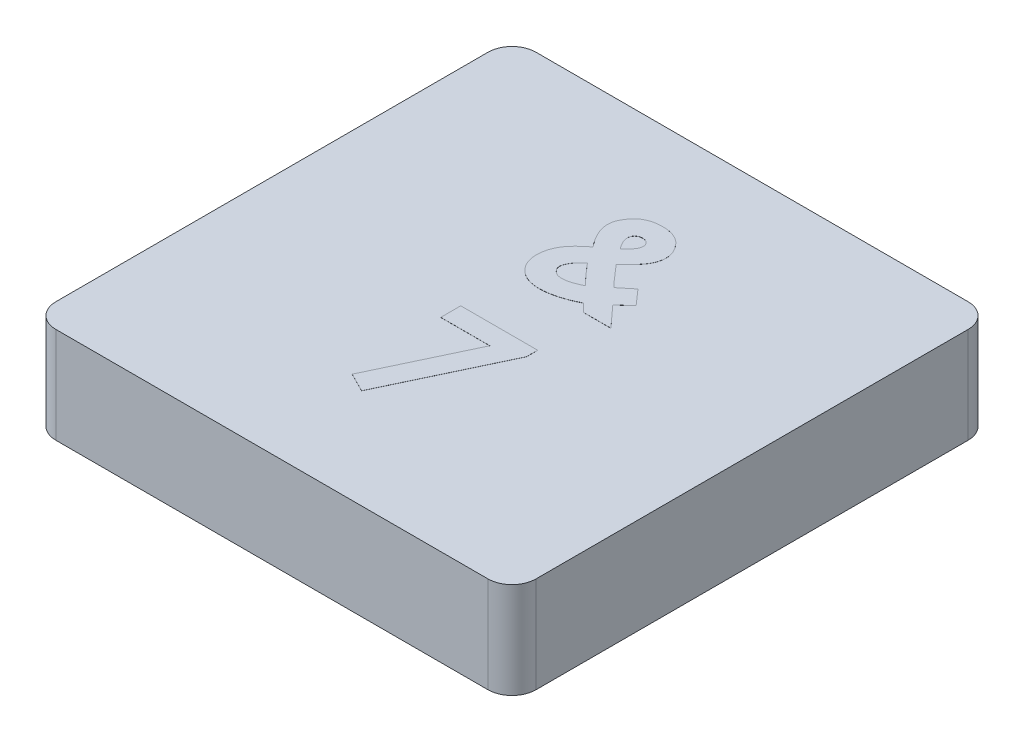
from build123d import *

# Parameters (mm, degrees)
SKETCH1_W           = 12.7
SKETCH1_H           = 12.7
BOSS_EXTRUDE1_DEPTH = 2.54
FILLET1_R           = 0.635
SHELL1_START        = 0.635
SHELL1_OUTLINE_W    = 1.905
SHELL1_OUTLINE_H    = 11.43
SHELL1_DEPTH        = 11.43
SKETCH2_R           = 2.54
BOSS_EXTRUDE2_DEPTH = 1.905
BOSS_EXTRUDE4_DEPTH = 0.00254


# Read off the part's stored shape, not the designer's step: Shell1
with BuildPart() as part:
    # Sketch1 → Boss-Extrude1 (new body)
    with BuildSketch(Plane(origin=(0, 0, 0), x_dir=(1, 0, 0), z_dir=(0, 1, 0))):
        with Locations((6.35, 6.35)):
            Rectangle(SKETCH1_W, SKETCH1_H)
    extrude(amount=BOSS_EXTRUDE1_DEPTH)

    # Fillet1
    fillet1_edges = [part.edges().sort_by_distance(p)[0] for p in [
        (0, 1.27, -12.7),
        (12.7, 1.27, -12.7),
        (12.7, 1.27, 0),
        (0, 1.27, 0),
    ]]
    fillet(fillet1_edges, radius=FILLET1_R)

    # Shell1 outline → Shell1 (cut)
    with BuildSketch(Plane.YZ.offset(SHELL1_START)):
        with Locations((0.9525, -6.35)):
            Rectangle(SHELL1_OUTLINE_W, SHELL1_OUTLINE_H)
    extrude(amount=SHELL1_DEPTH, mode=Mode.SUBTRACT)

    # Sketch2 → Boss-Extrude2 (add)
    with BuildSketch(Plane(origin=(0, 1.905, 0), x_dir=(-1, 0, 0), z_dir=(0, -1, 0))):
        with Locations(Location((-6.35, 6.35, 0), (0, 0, 270))):
            Circle(SKETCH2_R)
    extrude(amount=BOSS_EXTRUDE2_DEPTH)

    # Sketch4 → Boss-Extrude4 (add)
    # profile 1 of 2: a face of its own
    with BuildSketch(Plane(origin=(0, 2.54, 0), x_dir=(1, 0, 0), z_dir=(0, 1, 0))):
        Polygon((5.451230769, 5.8928), (7.486487179, 5.8928), (7.486487179, 5.597051803), (6.085976362, 2.636389744), (5.580978365, 2.890796795), (6.751250801, 5.363633333), (5.451230769, 5.363633333), align=None)
    # profile 2 of 2: a face of its own
    with BuildSketch(Plane(origin=(0, 2.54, 0), x_dir=(1, 0, 0), z_dir=(0, 1, 0))):
        with BuildLine():
            Line((7.409096554, 8.622770833), (7.766538462, 8.216991587))
            Line((7.766538462, 8.216991587), (7.603081931, 8.069435497))
            Line((7.603081931, 8.069435497), (7.441533454, 7.924423478))
            Line((7.441533454, 7.924423478), (7.949711538, 7.366))
            Line((7.949711538, 7.366), (7.222743389, 7.366))
            Line((7.222743389, 7.366), (7.015401643, 7.580973958))
            add(Edge.make_bspline(
                [(7.015401643, 7.580973958), (6.97444801, 7.560673161), (6.894181, 7.520884644), (6.773253322, 7.468717966), (6.654685877, 7.424432773), (6.538018022, 7.388798773), (6.423564891, 7.360717899), (6.311277459, 7.340102208), (6.201167743, 7.327468775), (6.128400542, 7.326012527), (6.092540064, 7.325294872)],
                knots=[0, 0, 0, 0, 1.134891057, 2.224328022, 3.268734328, 4.276239557, 5.251753187, 6.19349853, 7.109736169, 8, 8, 8, 8], degree=3))
            add(Edge.make_bspline(
                [(6.092540064, 7.325294872), (6.063034429, 7.325796424), (6.005322209, 7.326777447), (5.921188748, 7.337631506), (5.840996101, 7.353018844), (5.765418119, 7.376002636), (5.693887229, 7.405330125), (5.627212867, 7.442085237), (5.563639801, 7.483658229), (5.506101146, 7.532882757), (5.454020224, 7.586857726), (5.408064059, 7.644561561), (5.369257191, 7.706362361), (5.338512477, 7.772171642), (5.312977544, 7.841118603), (5.296538962, 7.914080952), (5.284832221, 7.990403359), (5.283968057, 8.04267472), (5.283525641, 8.069435497)],
                knots=[0, 0, 0, 0, 1.146320485, 2.242171696, 3.292771085, 4.317415236, 5.307674559, 6.292327784, 7.272937241, 8.255380553, 9.228759612, 10.185102518, 11.118113404, 12.058159412, 13.004506672, 13.970038596, 14.960743665, 16, 16, 16, 16], degree=3))
            add(Edge.make_bspline(
                [(5.283525641, 8.069435497), (5.285136738, 8.110051238), (5.288345469, 8.1909433), (5.313640854, 8.310302809), (5.353809539, 8.426236269), (5.400952856, 8.519265038), (5.446819309, 8.59254431), (5.488720732, 8.647552338), (5.535160587, 8.703790883), (5.587347614, 8.760305349), (5.645545647, 8.817160167), (5.709882384, 8.873904262), (5.77900736, 8.932164365), (5.828205116, 8.96940926), (5.853397436, 8.98848097)],
                knots=[0, 0, 0, 0, 1.298446345, 2.586041726, 3.88590443, 5.214452458, 5.912551437, 6.649127465, 7.424614693, 8.245404032, 9.108723099, 10.02626188, 10.989322942, 12, 12, 12, 12], degree=3))
            add(Edge.make_bspline(
                [(5.853397436, 8.98848097), (5.827559755, 9.021257842), (5.777543868, 9.084706429), (5.711505763, 9.181511898), (5.655141147, 9.275021591), (5.608821582, 9.36561685), (5.572908738, 9.453473314), (5.547117983, 9.53858128), (5.530925354, 9.620914059), (5.528793375, 9.675100959), (5.52775641, 9.701456731)],
                knots=[0, 0, 0, 0, 1.254783331, 2.428975762, 3.521264868, 4.536304978, 5.485798762, 6.371253184, 7.2077997, 8, 8, 8, 8], degree=3))
            add(Edge.make_bspline(
                [(5.52775641, 9.701456731), (5.528380522, 9.720574249), (5.52963638, 9.759043148), (5.539526331, 9.816440273), (5.555794207, 9.873650013), (5.577737669, 9.930734936), (5.607306284, 9.987010631), (5.64120406, 10.043977629), (5.683245259, 10.099801566), (5.73026093, 10.155323483), (5.782631122, 10.208133579), (5.842073232, 10.253340749), (5.90566613, 10.292692093), (5.975384272, 10.323685635), (6.049609796, 10.348752242), (6.129486339, 10.365421702), (6.21411159, 10.376845296), (6.272492276, 10.377727271), (6.302425881, 10.378179487)],
                knots=[0, 0, 0, 0, 0.804005245, 1.617845782, 2.442417892, 3.303751945, 4.185353306, 5.113895693, 6.089730109, 7.121057753, 8.174368357, 9.210928466, 10.255745102, 11.313577991, 12.413626417, 13.545577246, 14.741540635, 16, 16, 16, 16], degree=3))
            add(Edge.make_bspline(
                [(6.302425881, 10.378179487), (6.332569573, 10.377722536), (6.39136896, 10.376831189), (6.476650223, 10.365468143), (6.556816829, 10.348636143), (6.631527852, 10.324533868), (6.700880775, 10.293161466), (6.764602292, 10.254855776), (6.823488659, 10.210021647), (6.875164543, 10.157828093), (6.921772987, 10.103243061), (6.961995209, 10.047470902), (6.996705175, 9.991938863), (7.025405352, 9.936359946), (7.047480339, 9.880322284), (7.062578015, 9.823963437), (7.072683503, 9.767539145), (7.073933625, 9.729694947), (7.074551282, 9.710996995)],
                knots=[0, 0, 0, 0, 1.276734626, 2.490445286, 3.63953842, 4.744903521, 5.810549869, 6.858432609, 7.890047049, 8.938430496, 9.964709099, 10.929889513, 11.849973453, 12.738086576, 13.577403443, 14.397009003, 15.207998884, 16, 16, 16, 16], degree=3))
            add(Edge.make_bspline(
                [(7.074551282, 9.710996995), (7.073477523, 9.681652887), (7.07134243, 9.623304189), (7.053209703, 9.536924488), (7.024449419, 9.452542626), (6.990618023, 9.383157447), (6.955339528, 9.326322118), (6.921196083, 9.27845718), (6.879896691, 9.225755696), (6.830529284, 9.168763191), (6.774558566, 9.106216415), (6.710774983, 9.038936218), (6.639742376, 8.966412127), (6.588968556, 8.917335112), (6.562557091, 8.89180629)],
                knots=[0, 0, 0, 0, 1.060977453, 2.109679181, 3.179605993, 4.281004361, 4.894184227, 5.598751118, 6.407550161, 7.316246525, 8.32673215, 9.444732117, 10.670803848, 12, 12, 12, 12], degree=3))
            add(Edge.make_bspline(
                [(6.562557091, 8.89180629), (6.593271294, 8.856166083), (6.651652628, 8.788421434), (6.73506492, 8.69246567), (6.809433761, 8.606610115), (6.876491377, 8.532369572), (6.933052055, 8.466733094), (6.983103843, 8.413663099), (7.023637363, 8.370251662), (7.048022863, 8.34501693), (7.058650841, 8.33401883)],
                knots=[0, 0, 0, 0, 1.512435367, 2.874826234, 4.08718363, 5.163660462, 6.090727043, 6.871951442, 7.508360509, 8, 8, 8, 8], degree=3))
            add(Edge.make_bspline(
                [(7.058650841, 8.33401883), (7.065417498, 8.339341484), (7.081216274, 8.351768806), (7.108880844, 8.372508864), (7.142506332, 8.400242817), (7.182820765, 8.433739543), (7.23008464, 8.472510346), (7.28372058, 8.517247148), (7.343948587, 8.568147254), (7.386610982, 8.603917714), (7.409096554, 8.622770833)],
                knots=[0, 0, 0, 0, 0.454985294, 1.062298784, 1.826991184, 2.758032328, 3.832541496, 5.05766532, 6.449217892, 8, 8, 8, 8], degree=3))
        make_face()
        with BuildLine():
            add(Edge.make_bspline(
                [(6.256632612, 9.310305889), (6.276099643, 9.326643614), (6.3134892, 9.358022836), (6.364210213, 9.406054817), (6.407572479, 9.452686593), (6.44240454, 9.498116851), (6.469920541, 9.542127789), (6.489901968, 9.584432629), (6.50226988, 9.625930388), (6.503893913, 9.653257267), (6.504679487, 9.666475761)],
                knots=[0, 0, 0, 0, 1.365060885, 2.621818505, 3.750342301, 4.782258275, 5.692552235, 6.533361441, 7.290560982, 8, 8, 8, 8], degree=3))
            add(Edge.make_bspline(
                [(6.504679487, 9.666475761), (6.504271465, 9.67951412), (6.503486032, 9.704612637), (6.491637727, 9.73989146), (6.474580642, 9.772079792), (6.449300477, 9.79898587), (6.419253722, 9.821875675), (6.383705957, 9.837510165), (6.343884895, 9.847485525), (6.315848087, 9.848487618), (6.301153846, 9.849012821)],
                knots=[0, 0, 0, 0, 1.014099219, 1.952115937, 2.87909245, 3.840951669, 4.811901314, 5.812921866, 6.853740603, 8, 8, 8, 8], degree=3))
            add(Edge.make_bspline(
                [(6.301153846, 9.849012821), (6.287542113, 9.848167376), (6.260781107, 9.846505211), (6.221787318, 9.836691055), (6.187107944, 9.817268809), (6.155981618, 9.792706314), (6.130326793, 9.763353415), (6.110957761, 9.730741837), (6.099973772, 9.695148684), (6.098413392, 9.670573715), (6.097628205, 9.658207532)],
                knots=[0, 0, 0, 0, 1.057365327, 2.078806644, 3.087050319, 4.117196135, 5.143130812, 6.093917617, 7.040854779, 8, 8, 8, 8], degree=3))
            add(Edge.make_bspline(
                [(6.097628205, 9.658207532), (6.098127155, 9.645236008), (6.099149553, 9.61865603), (6.107498934, 9.578466447), (6.119418944, 9.536534459), (6.137545666, 9.4937705), (6.160084718, 9.449364397), (6.187398735, 9.403968995), (6.219492896, 9.356884662), (6.243911965, 9.326259489), (6.256632612, 9.310305889)],
                knots=[0, 0, 0, 0, 0.79851103, 1.636230724, 2.520809257, 3.481398485, 4.492018109, 5.587460843, 6.74323377, 8, 8, 8, 8], degree=3))
        make_face(mode=Mode.SUBTRACT)
        with BuildLine():
            add(Edge.make_bspline(
                [(6.642695312, 8.003925681), (6.62719118, 8.018949023), (6.59424658, 8.050871993), (6.542618674, 8.102099606), (6.487422429, 8.161171898), (6.426932649, 8.226430711), (6.362326491, 8.298977804), (6.292850422, 8.378110776), (6.218393759, 8.46358123), (6.168120199, 8.523673797), (6.142149439, 8.554716947)],
                knots=[0, 0, 0, 0, 0.695851971, 1.478609945, 2.343846541, 3.301331317, 4.346617988, 5.474767113, 6.695492858, 8, 8, 8, 8], degree=3))
            add(Edge.make_bspline(
                [(6.142149439, 8.554716947), (6.119452635, 8.533533507), (6.075812303, 8.492802999), (6.016802084, 8.430755691), (5.966510012, 8.371013272), (5.926219845, 8.312669246), (5.893872128, 8.256750482), (5.870478778, 8.202478838), (5.856282223, 8.149872483), (5.854333792, 8.11530458), (5.853397436, 8.098692308)],
                knots=[0, 0, 0, 0, 1.345056216, 2.586209894, 3.708339041, 4.725117826, 5.654925694, 6.502941046, 7.280559447, 8, 8, 8, 8], degree=3))
            add(Edge.make_bspline(
                [(5.853397436, 8.098692308), (5.854634949, 8.083731351), (5.857142831, 8.053412226), (5.873717911, 8.009034269), (5.902592719, 7.967870007), (5.939958625, 7.928763969), (5.986800916, 7.896351102), (6.039878203, 7.871255763), (6.099284763, 7.85754908), (6.14060102, 7.855510678), (6.161865986, 7.854461538)],
                knots=[0, 0, 0, 0, 0.827700581, 1.677376432, 2.581631432, 3.593486174, 4.654183907, 5.714103338, 6.823477321, 8, 8, 8, 8], degree=3))
            add(Edge.make_bspline(
                [(6.161865986, 7.854461538), (6.178424449, 7.855028605), (6.212733557, 7.856203567), (6.265439111, 7.863628743), (6.321174515, 7.875035743), (6.379656827, 7.891945875), (6.441381095, 7.913042508), (6.506274243, 7.938346703), (6.573746118, 7.969205779), (6.619237748, 7.992113442), (6.642695312, 8.003925681)],
                knots=[0, 0, 0, 0, 0.782455748, 1.62124697, 2.511300074, 3.469084929, 4.495559399, 5.593194182, 6.758940896, 8, 8, 8, 8], degree=3))
        make_face(mode=Mode.SUBTRACT)
    extrude(amount=BOSS_EXTRUDE4_DEPTH)


solid = part.part
